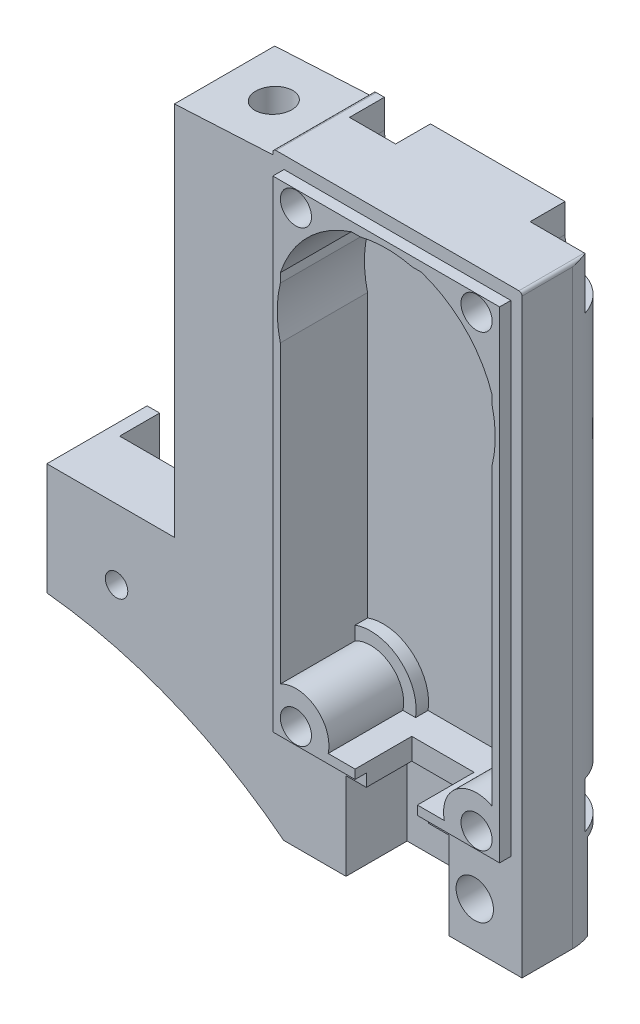
from build123d import *

# Parameters (mm, degrees)
SKETCH2_W                 = 20
SKETCH2_H                 = 40.65
BOSS_EXTRUDE2_DEPTH       = 7.05
SKETCH3_W                 = 18.2
SKETCH3_H                 = 38.65
BOSS_EXTRUDE3_DEPTH       = 0.9
CUT_EXTRUDE1_DEPTH        = 7
CUT_EXTRUDE4_REACH        = 40.342
SKETCH4_4_R               = 1.25
BOSS_EXTRUDE4_START       = 1
BOSS_EXTRUDE4_DEPTH       = 1
CUT_EXTRUDE5_START        = -1.8
SKETCH5_R                 = 1.85
SKETCH5_R_2               = 1.25
CUT_EXTRUDE5_DEPTH        = 1.8
CUT_EXTRUDE6_DEPTH        = 7.05
CUT_EXTRUDE7_REACH        = 161.774
SKETCH8_W                 = 5
SKETCH8_H                 = 4.55
SKETCH9_R                 = 1.85
BOSS_EXTRUDE5_DEPTH       = 1
BOSS_EXTRUDE7_DEPTH       = 8.05
CUT_EXTRUDE8_START        = -7
SKETCH12_W                = 8.257782218
SKETCH12_H                = 4.906896877
CUT_EXTRUDE8_DEPTH        = 7
CUT_EXTRUDE9_DEPTH        = 2.5
CUT_EXTRUDE10_START       = -8.05
SKETCH13_3_R              = 1.499999995
CUT_EXTRUDE10_DEPTH       = 5.55
CUT_EXTRUDE11_START       = -15.708035038
CUT_EXTRUDE11_OUTLINE_R   = 1.45
CUT_EXTRUDE11_DEPTH       = 15.283383801
CUT_EXTRUDE11_START_2     = -4.245021448
CUT_EXTRUDE11_2_OUTLINE_W = 6
CUT_EXTRUDE11_2_OUTLINE_H = 6
CUT_EXTRUDE11_2_DEPTH     = 1.245021448
FILLET1_R                 = 4
FILLET2_R                 = 1.5
BOSS_EXTRUDE8_START       = -8.05
SKETCH11_4_W              = 9.24
SKETCH11_4_H              = 8.36
SKETCH11_4_R              = 0.9
BOSS_EXTRUDE8_DEPTH       = 4.8402


with BuildPart() as part:
    # Sketch2 → Boss-Extrude2 (new body)
    with BuildSketch(Plane.XY.offset(150.825691762)):
        with Locations((21.495324698, -0.04622899)):
            Rectangle(SKETCH2_W, SKETCH2_H)
    extrude(amount=-BOSS_EXTRUDE2_DEPTH)

    # Sketch3 → Boss-Extrude3 (add)
    with BuildSketch(Plane.XY.offset(150.825691762)):
        with Locations((21.495324698, -0.04622899)):
            Rectangle(SKETCH3_W, SKETCH3_H)
    extrude(amount=BOSS_EXTRUDE3_DEPTH)

    # Sketch4 → Cut-Extrude1 (cut)
    with BuildSketch(Plane.XY.offset(151.725691762)):
        with BuildLine():
            Line((29.995324698, -15.734564701), (29.995324698, 7.977115044))
            ThreePointArc((29.995324698, 7.977115044), (21.495324698, 1.30377101), (12.995324698, 7.977115044))
            Line((12.995324698, 7.977115044), (12.995324698, -15.734564701))
            ThreePointArc((12.995324698, -15.734564701), (15.847276575, -15.960245764), (16.832190562, -18.64622899))
            Line((16.832190562, -18.64622899), (26.158458833, -18.64622899))
            ThreePointArc((26.158458833, -18.64622899), (27.14337282, -15.960245764), (29.995324698, -15.734564701))
        make_face()
        with BuildLine():
            Line((29.995324698, 7.977115044), (29.995324698, 12.130426976))
            ThreePointArc((29.995324698, 12.130426976), (27.682509033, 16.240955345), (23.571980663, 18.55377101))
            Line((23.571980663, 18.55377101), (19.418668732, 18.55377101))
            ThreePointArc((19.418668732, 18.55377101), (15.308140362, 16.240955345), (12.995324698, 12.130426976))
            Line((12.995324698, 12.130426976), (12.995324698, 7.977115044))
            ThreePointArc((12.995324698, 7.977115044), (21.495324698, 1.30377101), (29.995324698, 7.977115044))
        make_face()
        with BuildLine():
            ThreePointArc((12.995324698, 12.130426976), (15.308140362, 16.240955345), (19.418668732, 18.55377101))
            Line((19.418668732, 18.55377101), (18.693093444, 18.55377101))
            ThreePointArc((18.693093444, 18.55377101), (15.166719006, 16.382376702), (12.995324698, 12.856002264))
            Line((12.995324698, 12.856002264), (12.995324698, 12.130426976))
        make_face()
        with BuildLine():
            Line((19.418668732, 18.55377101), (23.571980663, 18.55377101))
            ThreePointArc((23.571980663, 18.55377101), (21.495324698, 18.80377101), (19.418668732, 18.55377101))
        make_face()
        with BuildLine():
            Line((29.995324698, 12.130426976), (29.995324698, 12.856002264))
            ThreePointArc((29.995324698, 12.856002264), (27.823930389, 16.382376702), (24.297555951, 18.55377101))
            Line((24.297555951, 18.55377101), (23.571980663, 18.55377101))
            ThreePointArc((23.571980663, 18.55377101), (27.682509033, 16.240955345), (29.995324698, 12.130426976))
        make_face()
        with BuildLine():
            ThreePointArc((12.995324698, 12.130426976), (12.745324698, 10.05377101), (12.995324698, 7.977115044))
            Line((12.995324698, 7.977115044), (12.995324698, 12.130426976))
        make_face()
        with BuildLine():
            ThreePointArc((30.245324698, 10.05377101), (30.182599875, 11.099596043), (29.995324698, 12.130426976))
            Line((29.995324698, 12.130426976), (29.995324698, 7.977115044))
            ThreePointArc((29.995324698, 7.977115044), (30.182599875, 9.007945977), (30.245324698, 10.05377101))
        make_face()
    extrude(amount=-CUT_EXTRUDE1_DEPTH, mode=Mode.SUBTRACT)

    # Sketch4<4> → Cut-Extrude4 (cut, up to next)
    with BuildSketch(Plane.XY.offset(151.725691762), mode=Mode.PRIVATE) as cut_extrude4_sk1:
        with BuildLine():
            ThreePointArc((29.855223342, -18.64622899), (29.959794398, -18.367140037), (29.995324698, -18.07122899))
            ThreePointArc((29.995324698, -18.07122899), (28.449413651, -16.85675929), (27.635426054, -18.64622899))
            Line((27.635426054, -18.64622899), (29.855223342, -18.64622899))
        make_face()
    cut_extrude4_tool1 = extrude(cut_extrude4_sk1.sketch, amount=-CUT_EXTRUDE4_REACH, mode=Mode.PRIVATE) & part.part
    # Sketch4<4> → Cut-Extrude4 (cut, up to next)
    with BuildSketch(Plane.XY.offset(151.725691762), mode=Mode.PRIVATE) as cut_extrude4_sk2:
        with BuildLine():
            Line((29.855223342, -18.64622899), (27.635426054, -18.64622899))
            ThreePointArc((27.635426054, -18.64622899), (28.745324698, -19.32122899), (29.855223342, -18.64622899))
        make_face()
    cut_extrude4_tool2 = extrude(cut_extrude4_sk2.sketch, amount=-CUT_EXTRUDE4_REACH, mode=Mode.PRIVATE) & part.part
    # Sketch4<4> → Cut-Extrude4 (cut, up to next)
    with BuildSketch(Plane.XY.offset(151.725691762), mode=Mode.PRIVATE) as cut_extrude4_sk3:
        with BuildLine():
            ThreePointArc((29.855223342, -18.64622899), (29.959794398, -18.367140037), (29.995324698, -18.07122899))
            ThreePointArc((29.995324698, -18.07122899), (28.449413651, -16.85675929), (27.635426054, -18.64622899))
            Line((27.635426054, -18.64622899), (29.855223342, -18.64622899))
        make_face()
    cut_extrude4_tool3 = extrude(cut_extrude4_sk3.sketch, amount=-CUT_EXTRUDE4_REACH, mode=Mode.PRIVATE) & part.part
    # Sketch4<4> → Cut-Extrude4 (cut, up to next)
    with BuildSketch(Plane.XY.offset(151.725691762), mode=Mode.PRIVATE) as cut_extrude4_sk4:
        with BuildLine():
            Line((29.855223342, -18.64622899), (27.635426054, -18.64622899))
            ThreePointArc((27.635426054, -18.64622899), (28.745324698, -19.32122899), (29.855223342, -18.64622899))
        make_face()
    cut_extrude4_tool4 = extrude(cut_extrude4_sk4.sketch, amount=-CUT_EXTRUDE4_REACH, mode=Mode.PRIVATE) & part.part
    # Sketch4<4> → Cut-Extrude4 (cut, up to next)
    with BuildSketch(Plane.XY.offset(151.725691762), mode=Mode.PRIVATE) as cut_extrude4_sk5:
        with Locations((14.245324698, -18.07122899)):
            Circle(SKETCH4_4_R)
    cut_extrude4_tool5 = extrude(cut_extrude4_sk5.sketch, amount=-CUT_EXTRUDE4_REACH, mode=Mode.PRIVATE) & part.part
    # Sketch4<4> → Cut-Extrude4 (cut, up to next)
    with BuildSketch(Plane.XY.offset(151.725691762), mode=Mode.PRIVATE) as cut_extrude4_sk6:
        with Locations((28.745324698, 17.97877101)):
            Circle(SKETCH4_4_R)
    cut_extrude4_tool6 = extrude(cut_extrude4_sk6.sketch, amount=-CUT_EXTRUDE4_REACH, mode=Mode.PRIVATE) & part.part
    # Sketch4<4> → Cut-Extrude4 (cut, up to next)
    with BuildSketch(Plane.XY.offset(151.725691762), mode=Mode.PRIVATE) as cut_extrude4_sk7:
        with Locations((14.245324698, 17.97877101)):
            Circle(SKETCH4_4_R)
    cut_extrude4_tool7 = extrude(cut_extrude4_sk7.sketch, amount=-CUT_EXTRUDE4_REACH, mode=Mode.PRIVATE) & part.part
    add(cut_extrude4_tool1.solids().sort_by_distance((28.745325, -17.833823, 151.725692))[0], mode=Mode.SUBTRACT)
    add(cut_extrude4_tool2.solids().sort_by_distance((28.745325, -18.923652, 151.725692))[0], mode=Mode.SUBTRACT)
    add(cut_extrude4_tool3.solids().sort_by_distance((28.745325, -17.833823, 151.725692))[0], mode=Mode.SUBTRACT)
    add(cut_extrude4_tool4.solids().sort_by_distance((28.745325, -18.923652, 151.725692))[0], mode=Mode.SUBTRACT)
    add(cut_extrude4_tool5.solids().sort_by_distance((14.245325, -18.071229, 151.725692))[0], mode=Mode.SUBTRACT)
    add(cut_extrude4_tool6.solids().sort_by_distance((28.745325, 17.978771, 151.725692))[0], mode=Mode.SUBTRACT)
    add(cut_extrude4_tool7.solids().sort_by_distance((14.245325, 17.978771, 151.725692))[0], mode=Mode.SUBTRACT)

    # Sketch6 → Boss-Extrude4 (add)
    with BuildSketch(Plane.XY.offset(144.725691762).offset(BOSS_EXTRUDE4_START)):
        with BuildLine():
            ThreePointArc((13.658334388, 14.376279875), (16.709025437, 15.285691236), (17.885705242, 18.243590751))
            ThreePointArc((17.885705242, 18.243590751), (15.454195488, 16.657350181), (13.658334388, 14.376279875))
        make_face()
        with BuildLine():
            ThreePointArc((17.849749062, -18.64622899), (16.56791041, -15.255541577), (12.995324698, -14.64194335))
            Line((12.995324698, -14.64194335), (12.995324698, -15.734564701))
            ThreePointArc((12.995324698, -15.734564701), (15.847276575, -15.960245764), (16.832190562, -18.64622899))
            Line((16.832190562, -18.64622899), (17.849749062, -18.64622899))
        make_face()
        with BuildLine():
            ThreePointArc((29.332315007, 14.376279875), (27.536453908, 16.657350181), (25.104944154, 18.243590751))
            ThreePointArc((25.104944154, 18.243590751), (26.281623958, 15.285691236), (29.332315007, 14.376279875))
        make_face()
        with BuildLine():
            ThreePointArc((29.995324698, -14.64194335), (26.422738985, -15.255541577), (25.140900333, -18.64622899))
            Line((25.140900333, -18.64622899), (26.158458833, -18.64622899))
            ThreePointArc((26.158458833, -18.64622899), (27.14337282, -15.960245764), (29.995324698, -15.734564701))
            Line((29.995324698, -15.734564701), (29.995324698, -14.64194335))
        make_face()
    extrude(amount=-BOSS_EXTRUDE4_DEPTH)

    # Sketch5 → Cut-Extrude5 (cut)
    # profile 1 of 7: a face of its own
    with BuildSketch(Plane(origin=(0, 0, 143.775691762), x_dir=(-1, 0, 0), z_dir=(0, 0, -1)).offset(CUT_EXTRUDE5_START)):
        with BuildLine():
            Line((-28.745324698, -16.22122899), (-31.495324698, -16.22122899))
            Line((-31.495324698, -16.22122899), (-31.495324698, -19.92122899))
            Line((-31.495324698, -19.92122899), (-28.745324698, -19.92122899))
            ThreePointArc((-28.745324698, -19.92122899), (-30.595324698, -18.07122899), (-28.745324698, -16.22122899))
        make_face()
    # profile 2 of 7: a face of its own
    with BuildSketch(Plane(origin=(0, 0, 143.775691762), x_dir=(-1, 0, 0), z_dir=(0, 0, -1)).offset(CUT_EXTRUDE5_START)):
        with Locations((-28.745324698, -18.07122899)):
            Circle(SKETCH5_R)
        with Locations(Location((-28.745324698, -18.07122899, 0), (0, 0, 180))):
            Circle(SKETCH5_R_2, mode=Mode.SUBTRACT)
    # profile 3 of 7: a face of its own
    with BuildSketch(Plane(origin=(0, 0, 143.775691762), x_dir=(-1, 0, 0), z_dir=(0, 0, -1)).offset(CUT_EXTRUDE5_START)):
        with Locations((-14.245324698, -18.07122899)):
            Circle(SKETCH5_R)
        with Locations(Location((-14.245324698, -18.07122899, 0), (0, 0, 180))):
            Circle(SKETCH5_R_2, mode=Mode.SUBTRACT)
    # profile 4 of 7: a face of its own
    with BuildSketch(Plane(origin=(0, 0, 143.775691762), x_dir=(-1, 0, 0), z_dir=(0, 0, -1)).offset(CUT_EXTRUDE5_START)):
        with BuildLine():
            Line((-12.395324698, 20.27877101), (-16.095324698, 20.27877101))
            Line((-16.095324698, 20.27877101), (-16.095324698, 17.97877101))
            ThreePointArc((-16.095324698, 17.97877101), (-14.245324698, 19.82877101), (-12.395324698, 17.97877101))
            Line((-12.395324698, 17.97877101), (-12.395324698, 20.27877101))
        make_face()
    # profile 5 of 7: a face of its own
    with BuildSketch(Plane(origin=(0, 0, 143.775691762), x_dir=(-1, 0, 0), z_dir=(0, 0, -1)).offset(CUT_EXTRUDE5_START)):
        with Locations((-14.245324698, 17.97877101)):
            Circle(SKETCH5_R)
        with Locations(Location((-14.245324698, 17.97877101, 0), (0, 0, 180))):
            Circle(SKETCH5_R_2, mode=Mode.SUBTRACT)
    # profile 6 of 7: a face of its own
    with BuildSketch(Plane(origin=(0, 0, 143.775691762), x_dir=(-1, 0, 0), z_dir=(0, 0, -1)).offset(CUT_EXTRUDE5_START)):
        with BuildLine():
            Line((-31.495324698, 16.12877101), (-28.745324698, 16.12877101))
            ThreePointArc((-28.745324698, 16.12877101), (-30.053472243, 19.286918555), (-26.895324698, 17.97877101))
            Line((-26.895324698, 17.97877101), (-26.895324698, 20.27877101))
            Line((-26.895324698, 20.27877101), (-31.495324698, 20.27877101))
            Line((-31.495324698, 20.27877101), (-31.495324698, 16.12877101))
        make_face()
    # profile 7 of 7: a face of its own
    with BuildSketch(Plane(origin=(0, 0, 143.775691762), x_dir=(-1, 0, 0), z_dir=(0, 0, -1)).offset(CUT_EXTRUDE5_START)):
        with Locations((-28.745324698, 17.97877101)):
            Circle(SKETCH5_R)
        with Locations(Location((-28.745324698, 17.97877101, 0), (0, 0, 180))):
            Circle(SKETCH5_R_2, mode=Mode.SUBTRACT)
    extrude(amount=CUT_EXTRUDE5_DEPTH, mode=Mode.SUBTRACT)

    # Sketch7 → Cut-Extrude6 (cut)
    with BuildSketch(Plane(origin=(0, 0, 143.775691762), x_dir=(-1, 0, 0), z_dir=(0, 0, -1))):
        with BuildLine():
            Line((-31.495324698, -20.37122899), (-31.245324698, -20.37122899))
            ThreePointArc((-31.245324698, -20.37122899), (-31.422101393, -20.298005685), (-31.495324698, -20.12122899))
            Line((-31.495324698, -20.12122899), (-31.495324698, -20.37122899))
        make_face()
        with BuildLine():
            Line((-11.745324698, -20.37122899), (-11.495324698, -20.37122899))
            Line((-11.495324698, -20.37122899), (-11.495324698, -20.12122899))
            ThreePointArc((-11.495324698, -20.12122899), (-11.568548002, -20.298005685), (-11.745324698, -20.37122899))
        make_face()
        with BuildLine():
            ThreePointArc((-11.745324698, 20.27877101), (-11.568548002, 20.205547706), (-11.495324698, 20.02877101))
            Line((-11.495324698, 20.02877101), (-11.495324698, 20.27877101))
            Line((-11.495324698, 20.27877101), (-11.745324698, 20.27877101))
        make_face()
        with BuildLine():
            ThreePointArc((-31.245324698, 20.27877101), (-31.422101393, 20.205547706), (-31.495324698, 20.02877101))
            Line((-31.495324698, 20.02877101), (-31.495324698, 20.27877101))
            Line((-31.495324698, 20.27877101), (-31.245324698, 20.27877101))
        make_face()
    extrude(amount=-CUT_EXTRUDE6_DEPTH, mode=Mode.SUBTRACT)

    # Sketch8 → Cut-Extrude7 (cut, up to next)
    with BuildSketch(Plane(origin=(0, -18.64622899, 0), x_dir=(1, 0, 0), z_dir=(0, 1, 0)), mode=Mode.PRIVATE) as cut_extrude7_sk1:
        with Locations((21.495324698, -149.450691762)):
            Rectangle(SKETCH8_W, SKETCH8_H)
    cut_extrude7_tool1 = extrude(cut_extrude7_sk1.sketch, amount=-CUT_EXTRUDE7_REACH, mode=Mode.PRIVATE) & part.part
    add(cut_extrude7_tool1.solids().sort_by_distance((21.495325, -18.646229, 149.450692))[0], mode=Mode.SUBTRACT)

    # Sketch9 → Boss-Extrude5 (add)
    with BuildSketch(Plane(origin=(0, 0, 143.775691762), x_dir=(-1, 0, 0), z_dir=(0, 0, -1))):
        with BuildLine():
            ThreePointArc((-11.745324698, -20.37122899), (-11.568548002, -20.298005685), (-11.495324698, -20.12122899))
            Line((-11.495324698, -20.12122899), (-11.495324698, 20.02877101))
            ThreePointArc((-11.495324698, 20.02877101), (-11.568548002, 20.205547706), (-11.745324698, 20.27877101))
            Line((-11.745324698, 20.27877101), (-12.395324698, 20.27877101))
            Line((-12.395324698, 20.27877101), (-12.395324698, 17.97877101))
            ThreePointArc((-12.395324698, 17.97877101), (-14.245324698, 16.12877101), (-16.095324698, 17.97877101))
            Line((-16.095324698, 17.97877101), (-16.095324698, 20.27877101))
            Line((-16.095324698, 20.27877101), (-26.895324698, 20.27877101))
            Line((-26.895324698, 20.27877101), (-26.895324698, 17.97877101))
            ThreePointArc((-26.895324698, 17.97877101), (-27.437177152, 16.670623465), (-28.745324698, 16.12877101))
            Line((-28.745324698, 16.12877101), (-31.495324698, 16.12877101))
            Line((-31.495324698, 16.12877101), (-31.495324698, -16.22122899))
            Line((-31.495324698, -16.22122899), (-28.745324698, -16.22122899))
            ThreePointArc((-28.745324698, -16.22122899), (-26.895324698, -18.07122899), (-28.745324698, -19.92122899))
            Line((-28.745324698, -19.92122899), (-31.495324698, -19.92122899))
            Line((-31.495324698, -19.92122899), (-31.495324698, -20.12122899))
            ThreePointArc((-31.495324698, -20.12122899), (-31.422101393, -20.298005685), (-31.245324698, -20.37122899))
            Line((-31.245324698, -20.37122899), (-11.745324698, -20.37122899))
        make_face()
        with Locations((-14.245324698, -18.07122899)):
            Circle(SKETCH9_R, mode=Mode.SUBTRACT)
    extrude(amount=BOSS_EXTRUDE5_DEPTH)

    # Sketch11 → Boss-Extrude7 (add)
    with BuildSketch(Plane(origin=(0, 0, 142.775691762), x_dir=(-1, 0, 0), z_dir=(0, 0, -1))):
        with BuildLine():
            ThreePointArc((-12.363529237, -27.37122899), (-11.931858956, -27.037692555), (-11.495324698, -26.710547897))
            Line((-11.495324698, -26.710547897), (-11.495324698, -20.12122899))
            ThreePointArc((-11.495324698, -20.12122899), (-11.568548002, -20.298005685), (-11.745324698, -20.37122899))
            Line((-11.745324698, -20.37122899), (-31.245324698, -20.37122899))
            ThreePointArc((-31.245324698, -20.37122899), (-31.422101393, -20.298005685), (-31.495324698, -20.12122899))
            Line((-31.495324698, -20.12122899), (-31.495324698, -27.37122899))
            Line((-31.495324698, -27.37122899), (-12.363529237, -27.37122899))
        make_face()
        with BuildLine():
            ThreePointArc((-11.495324698, -26.710547897), (-7.682005328, -24.242455478), (-3.595324698, -22.259546951))
            Line((-3.595324698, -22.259546951), (-3.595324698, -19.053373874))
            Line((-3.595324698, -19.053373874), (-3.595324698, -10.693373874))
            Line((-3.595324698, -10.693373874), (-3.595324698, 19.439539914))
            Line((-3.595324698, 19.439539914), (-11.495324698, 19.854119773))
            Line((-11.495324698, 19.854119773), (-11.495324698, -20.12122899))
            Line((-11.495324698, -20.12122899), (-11.495324698, -26.710547897))
        make_face()
        with BuildLine():
            ThreePointArc((-3.595324698, -22.259546951), (1.432046771, -20.599663997), (6.644675302, -19.673284428))
            Line((6.644675302, -19.673284428), (6.644675302, -10.693373874))
            Line((6.644675302, -10.693373874), (5.644675302, -10.693373874))
            Line((5.644675302, -10.693373874), (5.644675302, -19.053373874))
            Line((5.644675302, -19.053373874), (-3.595324698, -19.053373874))
            Line((-3.595324698, -19.053373874), (-3.595324698, -22.259546951))
        make_face()
    extrude(amount=-BOSS_EXTRUDE7_DEPTH)

    # Sketch12 → Cut-Extrude8 (cut)
    with BuildSketch(Plane.XZ.offset(27.37122899).offset(CUT_EXTRUDE8_START)):
        with Locations((21.495324698, 148.372243324)):
            Rectangle(SKETCH12_W, SKETCH12_H)
    extrude(amount=CUT_EXTRUDE8_DEPTH, mode=Mode.SUBTRACT)

    # Sketch13 → Cut-Extrude9 (cut)
    with BuildSketch(Plane(origin=(0, 0, 142.775691762), x_dir=(-1, 0, 0), z_dir=(0, 0, -1))):
        with BuildLine():
            Line((-25.728428709, -27.37122899), (-25.728428709, -26.381755197))
            ThreePointArc((-25.728428712, -26.381755192), (-24.598475851, -22.727703268), (-27.703428709, -20.494285106))
            Line((-27.703428709, -20.494285101), (-31.495324698, -20.494285101))
            Line((-31.495324698, -20.494285101), (-31.495324698, -27.37122899))
            Line((-31.495324698, -27.37122899), (-25.728428709, -27.37122899))
        make_face()
    extrude(amount=-CUT_EXTRUDE9_DEPTH, mode=Mode.SUBTRACT)

    # Sketch13<3> → Cut-Extrude10 (cut)
    with BuildSketch(Plane(origin=(0, 0, 142.775691762), x_dir=(-1, 0, 0), z_dir=(0, 0, -1)).offset(CUT_EXTRUDE10_START)):
        with Locations((-27.703428709, -23.769285101)):
            Circle(SKETCH13_3_R)
    extrude(amount=CUT_EXTRUDE10_DEPTH, mode=Mode.SUBTRACT)

    # Cut-Extrude11: read off the stored shape, not the designer's step
    # Cut-Extrude11 outline → Cut-Extrude11 (cut)
    with BuildSketch(Plane(origin=(0, 20.27877101, 0), x_dir=(1, 0, 0), z_dir=(0, 1, 0)).offset(CUT_EXTRUDE11_START)):
        with Locations((7.545324698, -146.800691762)):
            Circle(CUT_EXTRUDE11_OUTLINE_R)
    extrude(amount=CUT_EXTRUDE11_DEPTH, mode=Mode.SUBTRACT)

    # Cut-Extrude11 2 outline → Cut-Extrude11 2 (add)
    with BuildSketch(Plane(origin=(0, 0, 0), x_dir=(0.9986258431157958, 0.052406349436551286, 0), z_dir=(0.052406349436551286, -0.9986258431157958, 0)).offset(CUT_EXTRUDE11_START_2)):
        with Locations((8, 147)):
            Rectangle(CUT_EXTRUDE11_2_OUTLINE_W, CUT_EXTRUDE11_2_OUTLINE_H)
    extrude(amount=CUT_EXTRUDE11_2_DEPTH)

    # Fillet1
    # the kernel refuses this fillet: 4 mm, written as the material it takes off along each edge
    with BuildSketch(Plane(origin=(31.495324698, 26.12877101, 142.775691762), x_dir=(-1, 0, 0), z_dir=(0, -1, 0))) as fillet1_piece_1:
        with BuildLine():
            CenterArc((FILLET1_R, -FILLET1_R), FILLET1_R, 90, 90)
            Line((0, -FILLET1_R), (0, 0))
            Line((0, 0), (FILLET1_R, 0))
        make_face()
    extrude(amount=52.35, mode=Mode.SUBTRACT)
    with BuildSketch(Plane(origin=(31.495324698, -20.12122899, 142.775691762), x_dir=(-1.0, 1.999369252409243e-11, 0), z_dir=(-1.999369252409243e-11, -1.0, 0))) as fillet1_piece_2:
        with BuildLine():
            CenterArc((FILLET1_R, -FILLET1_R), FILLET1_R, 90, 90)
            Line((0, -FILLET1_R), (0, 0))
            Line((0, 0), (FILLET1_R, 0))
        make_face()
    extrude(amount=10.373056111, mode=Mode.SUBTRACT)
    with BuildSketch(Plane(origin=(31.495324698, -9.92122899, 142.775691762), x_dir=(-1, 0, 0), z_dir=(0, -1, 0))) as fillet1_piece_3:
        with BuildLine():
            CenterArc((FILLET1_R, -FILLET1_R), FILLET1_R, 90, 90)
            Line((0, -FILLET1_R), (0, 0))
            Line((0, 0), (FILLET1_R, 0))
        make_face()
    extrude(amount=10.2, mode=Mode.SUBTRACT)

    # Fillet2
    fillet2_edges = [part.edges().sort_by_distance(p)[0] for p in [
        (25.728428711, -26.381755194, 144.025691762),
    ]]
    fillet(fillet2_edges, radius=FILLET2_R)

    # Sketch11<4> → Boss-Extrude8 (add)
    with BuildSketch(Plane(origin=(0, 0, 142.775691762), x_dir=(-1, 0, 0), z_dir=(0, 0, -1)).offset(BOSS_EXTRUDE8_START)):
        with Locations((1.024675302, -14.873373874)):
            Rectangle(SKETCH11_4_W, SKETCH11_4_H)
        with Locations(Location((1.049675302, -16.313373874, 0), (0, 0, 90))):
            Circle(SKETCH11_4_R, mode=Mode.SUBTRACT)
    extrude(amount=BOSS_EXTRUDE8_DEPTH)


solid = part.part
